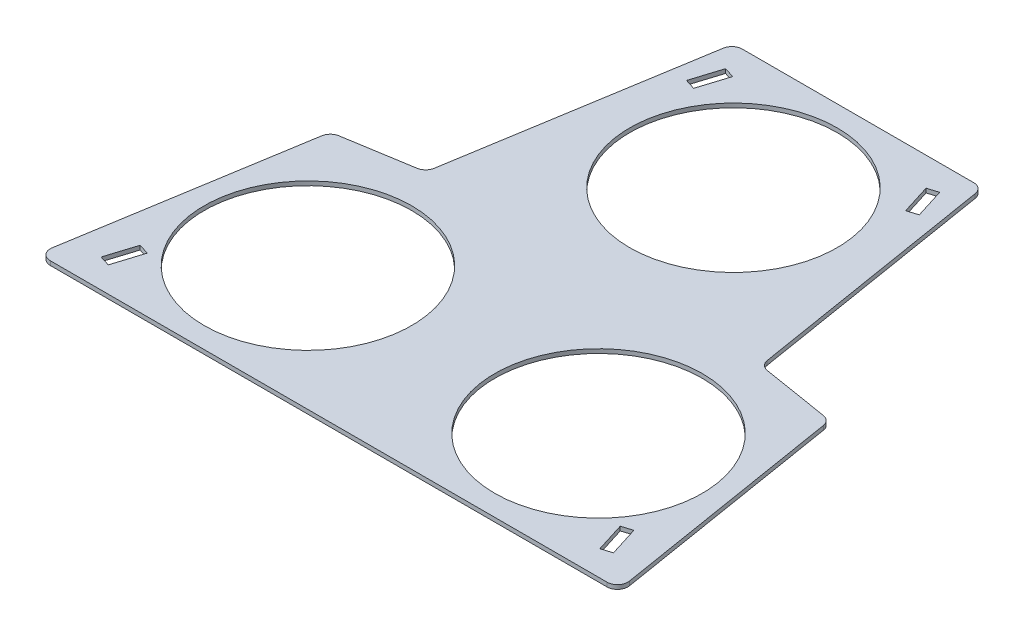
from build123d import *

# Parameters (mm, degrees)
SKETCH1_R           = 50
BOSS_EXTRUDE1_DEPTH = 2
CUT_EXTRUDE1_DEPTH  = 5


with BuildPart() as part:
    # Sketch1 → Boss-Extrude1 (new body)
    with BuildSketch(Plane(origin=(0, 0, 0), x_dir=(1, 0, 0), z_dir=(0, 1, 0))):
        with BuildLine():
            Line((-134.118891506, 0), (134.118891506, 0))
            ThreePointArc((134.118891506, 0), (137.928249972, 1.76136015), (139.053747558, 5.804484769))
            Line((139.053747558, 5.804484769), (120.84297072, 117.512705691))
            ThreePointArc((120.84297072, 117.512705691), (119.443648574, 120.243754828), (116.712599437, 121.643076974))
            Line((116.712599437, 121.643076974), (84.336583334, 126.921044874))
            ThreePointArc((84.336583334, 126.921044874), (81.605534197, 128.32036702), (80.206212051, 131.051416157))
            Line((80.206212051, 131.051416157), (60.683956749, 250.804484769))
            ThreePointArc((60.683956749, 250.804484769), (58.987740546, 253.809358466), (55.749100697, 255))
            Line((55.749100697, 255), (-55.749100697, 255))
            ThreePointArc((-55.749100697, 255), (-58.987740546, 253.809358466), (-60.683956749, 250.804484769))
            Line((-60.683956749, 250.804484769), (-80.206212051, 131.051416157))
            ThreePointArc((-80.206212051, 131.051416157), (-81.605534197, 128.32036702), (-84.336583334, 126.921044874))
            Line((-84.336583334, 126.921044874), (-116.712599437, 121.643076974))
            ThreePointArc((-116.712599437, 121.643076974), (-119.443648574, 120.243754828), (-120.84297072, 117.512705691))
            Line((-120.84297072, 117.512705691), (-139.053747558, 5.804484769))
            ThreePointArc((-139.053747558, 5.804484769), (-137.928249972, 1.76136015), (-134.118891506, 0))
        make_face()
        with Locations((0, 195)):
            Circle(SKETCH1_R, mode=Mode.SUBTRACT)
        with Locations((-70, 60)):
            Circle(SKETCH1_R, mode=Mode.SUBTRACT)
        with Locations((70, 60)):
            Circle(SKETCH1_R, mode=Mode.SUBTRACT)
    extrude(amount=BOSS_EXTRUDE1_DEPTH)

    # Sketch2 → Cut-Extrude1 (cut)
    with BuildSketch(Plane(origin=(0, 2, 0), x_dir=(1, 0, 0), z_dir=(0, 1, 0))):
        Polygon((-56.073926703, 228.471148892), (-51.583825585, 242.783346206), (-46.574556526, 241.211810815), (-51.064657644, 226.899613501), align=None)
        Polygon((-118.416174415, 12.216653794), (-113.926073297, 26.528851108), (-118.935342356, 28.100386499), (-123.425443474, 13.788189185), align=None)
        Polygon((123.425443474, 13.788189185), (118.935342356, 28.100386499), (113.926073297, 26.528851108), (118.416174415, 12.216653794), align=None)
        Polygon((51.064657644, 226.899613501), (46.574556526, 241.211810815), (51.583825585, 242.783346206), (56.073926703, 228.471148892), align=None)
    extrude(amount=-CUT_EXTRUDE1_DEPTH, mode=Mode.SUBTRACT)


solid = part.part
